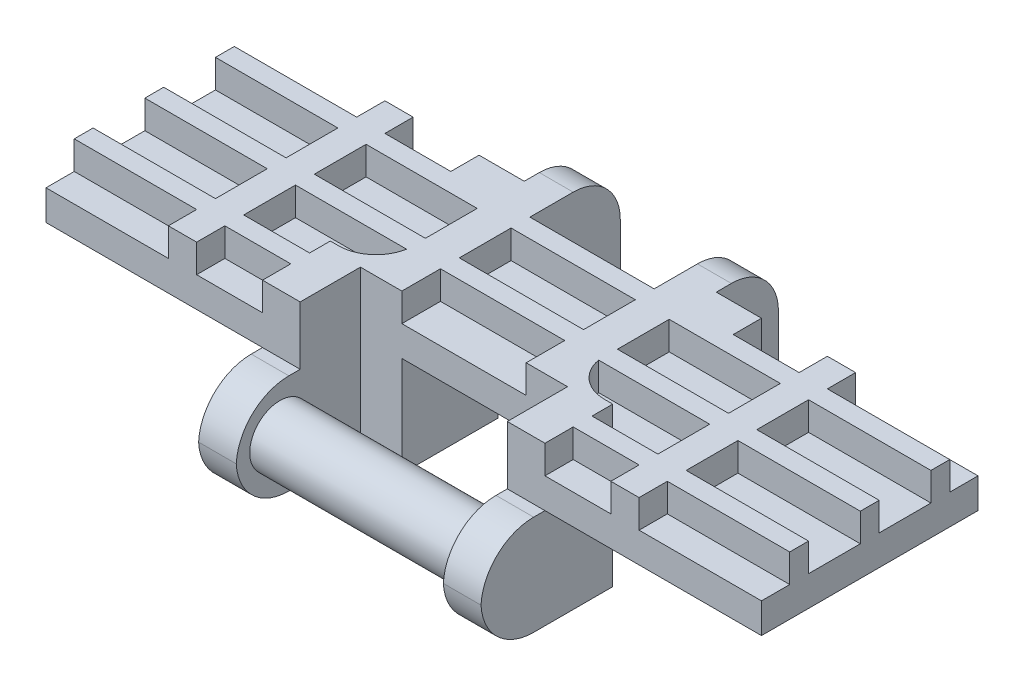
from build123d import *

# Parameters (mm, degrees)
SKETCH_1_W               = 38
SKETCH_1_H               = 11.5
EXTRUDE_1_DEPTH          = 1.6
EXTRUDE_START            = 1.6
SKETCH_1_3_W             = 38
SKETCH_1_3_H             = 1
SKETCH_1_3_W_2           = 1.5
SKETCH_1_3_H_2           = 11.5
EXTRUDE_2_DEPTH          = 1.5
EXTRUDE_START_2          = 3.1
EXTRUDE_3_DEPTH          = 8.4
SKETCH_2_4_W             = 2.4
SKETCH_2_4_H             = 1.5
EXTRUDE_5_DEPTH          = 3.1
CUT_EXTRUDE_1_DEPTH      = 22.744252114
FILLET_1_R               = 3
EXTRUDE_4_REACH          = 28.684
SKETCH_3_R               = 1.6
CUT_EXTRUDE_2_DEPTH      = 27.684499246
CUT_EXTRUDE_2_DEPTH_BACK = 27.684499246
SKETCH_3_3_R             = 1.7
SKETCH_3_3_W             = 6.5
SKETCH_3_3_H             = 1.7
SKETCH_3_3_W_2           = 3.4
SKETCH_3_3_H_2           = 3.1
FILLET_2_R               = 2.8
FILLET_3_R               = 2.5
FILLET_4_R               = 1
FILLET_5_R               = 0.5
FILLET_6_R               = 2


with BuildPart() as part:
    # 草图1 → 凸台-拉伸1 (new body)
    with BuildSketch(Plane(origin=(0, 0, 0), x_dir=(1, 0, 0), z_dir=(0, 1, 0))):
        Rectangle(SKETCH_1_W, SKETCH_1_H)
    extrude(amount=EXTRUDE_1_DEPTH)

    # 草图1<3> → 凸台-拉伸2 (add)
    with BuildSketch(Plane(origin=(0, 0, 0), x_dir=(1, 0, 0), z_dir=(0, 1, 0)).offset(EXTRUDE_START)):
        with Locations((0, 3.75)):
            Rectangle(SKETCH_1_3_W, SKETCH_1_3_H)
        Rectangle(SKETCH_1_3_W, SKETCH_1_3_H)
        with Locations((0, -3.75)):
            Rectangle(SKETCH_1_3_W, SKETCH_1_3_H)
        with Locations((-11.75, 0)):
            Rectangle(SKETCH_1_3_W_2, SKETCH_1_3_H_2)
        with Locations((11.75, 0)):
            Rectangle(SKETCH_1_3_W_2, SKETCH_1_3_H_2)
    extrude(amount=EXTRUDE_2_DEPTH)

    # 草图2 → 凸台-拉伸3 (add)
    with BuildSketch(Plane(origin=(0, 0, 0), x_dir=(1, 0, 0), z_dir=(0, 1, 0)).offset(EXTRUDE_START_2)):
        Polygon((-3.3, 9.05), (-5.1, 9.05), (-5.1, -2.15), (-7.5, -2.15), (-7.5, -9.15), (-5.5, -9.15), (-5.5, -2.55), (-3.3, -2.55), align=None)
        Polygon((5.1, 9.05), (3.3, 9.05), (3.3, -2.55), (5.5, -2.55), (5.5, -9.15), (7.5, -9.15), (7.5, -2.15), (5.1, -2.15), align=None)
    extrude(amount=-EXTRUDE_3_DEPTH)

    # 草图2<4> → 凸台-拉伸5 (add)
    with BuildSketch(Plane(origin=(0, 0, 0), x_dir=(1, 0, 0), z_dir=(0, 1, 0))):
        with Locations((-6.3, 5)):
            Rectangle(SKETCH_2_4_W, SKETCH_2_4_H)
        with Locations((6.3, 5)):
            Rectangle(SKETCH_2_4_W, SKETCH_2_4_H)
    extrude(amount=EXTRUDE_5_DEPTH)

    # 草图2<3> → 切除-拉伸1 (cut, through all)
    with BuildSketch(Plane(origin=(0, 0, 0), x_dir=(1, 0, 0), z_dir=(0, 1, 0))):
        Polygon((0, -9.15), (0, -2.55), (-3.3, -2.55), (-5.1, -2.55), (-5.5, -2.55), (-5.5, -9.15), align=None)
        Polygon((3.3, -2.55), (0, -2.55), (0, -9.15), (5.5, -9.15), (5.5, -2.55), (5.1, -2.55), align=None)
    extrude(amount=CUT_EXTRUDE_1_DEPTH, mode=Mode.SUBTRACT)

    # 圆角1
    # the kernel refuses this fillet: 3 mm, written as the material it adds along each edge
    with BuildSketch(Plane(origin=(5.1, 7.348469228, 2.15), x_dir=(0, 0, -1), z_dir=(0, -1, 0))) as fillet_1_piece_1_section:
        with BuildLine():
            CenterArc((2.939387691, 3), FILLET_1_R, 191.536959033, 78.463040967)
            Line((0, 2.4), (0, 0))
            Line((0, 0), (2.939387691, 0))
        make_face()
    fillet_1_piece_1 = extrude(amount=12.648469228, mode=Mode.PRIVATE)
    fillet_1_piece_1 = split(fillet_1_piece_1, bisect_by=Plane(origin=(5.102900281, 1.6, -0.644495887), z_dir=(0, -1, 0)), keep=Keep.TOP, mode=Mode.PRIVATE)
    add(fillet_1_piece_1)
    with BuildSketch(Plane(origin=(-5.1, 0, 2.15), x_dir=(0, 0, -1), z_dir=(0, -1, 0))) as fillet_1_piece_2:
        with BuildLine():
            CenterArc((2.939387691, -3), FILLET_1_R, 90, 78.463040967)
            Line((0, -2.4), (0, 0))
            Line((0, 0), (2.939387691, 0))
        make_face()
    extrude(amount=5.3)

    # 草图3 → 凸台-拉伸4 (add, up to next)
    with BuildSketch(Plane(origin=(-5.5, 0, 0), x_dir=(0, 0, -1), z_dir=(1, 0, 0)), mode=Mode.PRIVATE) as extrude_4_sk1:
        with Locations((-6.83, -2.5)):
            Circle(SKETCH_3_R)
    extrude_4_tool1 = extrude(extrude_4_sk1.sketch, amount=EXTRUDE_4_REACH, mode=Mode.PRIVATE) - part.part
    add(extrude_4_tool1.solids().sort_by_distance((-5.5, -2.5, 6.83))[0])

    # 草图3<3> → 切除-拉伸2 (cut, two sides: drawn at the far end of the back side and taken through both)
    with BuildSketch(Plane(origin=(-5.5, 0, 0), x_dir=(0, 0, -1), z_dir=(1, 0, 0)).offset(-CUT_EXTRUDE_2_DEPTH_BACK)):
        with Locations((5.75, -2.5)):
            Circle(SKETCH_3_3_R)
        with Locations((5.8, -4.45)):
            Rectangle(SKETCH_3_3_W, SKETCH_3_3_H)
        with Locations((-7.45, 1.55)):
            Rectangle(SKETCH_3_3_W_2, SKETCH_3_3_H_2)
    extrude(amount=CUT_EXTRUDE_2_DEPTH + CUT_EXTRUDE_2_DEPTH_BACK, mode=Mode.SUBTRACT)

    # 圆角2
    # the kernel refuses this fillet: 2.8 mm, written as the material it takes off along each edge
    with BuildSketch(Plane(origin=(-1.5, 0, 9.15), x_dir=(0, 0, -1), z_dir=(1, 0, 0)), Plane(origin=(-14.5, 0, 9.15), x_dir=(0, 0, -1), z_dir=(1, 0, 0))) as fillet_2_piece_1:
        with BuildLine():
            CenterArc((FILLET_2_R, -FILLET_2_R), FILLET_2_R, 90, 90)
            Line((0, -FILLET_2_R), (0, 0))
            Line((0, 0), (FILLET_2_R, 0))
        make_face()
    extrude(amount=16, mode=Mode.SUBTRACT)
    with BuildSketch(Plane(origin=(-1.5, -5.3, 9.15), x_dir=(0, 0, -1), z_dir=(1, 0, 0)), Plane(origin=(-14.5, -5.3, 9.15), x_dir=(0, 0, -1), z_dir=(1, 0, 0))) as fillet_2_piece_2:
        with BuildLine():
            CenterArc((FILLET_2_R, FILLET_2_R), FILLET_2_R, 180, 90)
            Line((0, FILLET_2_R), (0, 0))
            Line((0, 0), (FILLET_2_R, 0))
        make_face()
    extrude(amount=16, mode=Mode.SUBTRACT)

    # 圆角3
    fillet_3_edges = [part.edges().sort_by_distance(p)[0] for p in [
        (-4.2, 3.1, -9.05),
        (4.2, 3.1, -9.05),
    ]]
    fillet(fillet_3_edges, radius=FILLET_3_R)

    # 圆角4
    fillet_4_edges = [part.edges().sort_by_distance(p)[0] for p in [
        (-4.2, -3.6, -9.05),
        (4.2, -3.6, -9.05),
    ]]
    fillet(fillet_4_edges, radius=FILLET_4_R)

    # 圆角5
    fillet_5_edges = [part.edges().sort_by_distance(p)[0] for p in [
        (-4.2, -3.6, -4.45385186),
        (4.2, -3.6, -4.45385186),
        (-4.2, -3.6, -7.04614814),
        (4.2, -3.6, -7.04614814),
    ]]
    fillet(fillet_5_edges, radius=FILLET_5_R)

    # 圆角6
    # the kernel refuses this fillet: 2 mm, written as the material it adds along each edge
    with BuildSketch(Plane(origin=(5.1, 3.1, 2.15), x_dir=(0, 0, -1), z_dir=(0, -1, 0))) as fillet_6_piece_1:
        with BuildLine():
            CenterArc((2, 1.969136867), FILLET_6_R, 180, 79.921341892)
            Line((0, 1.969136867), (-0.04, 1.969136867))
            Line((-0.04, 1.969136867), (-0.04, 0))
            Line((-0.04, 0), (0, -0.04))
            ThreePointArc((0, -0.04), (0.825, -0.04), (1.643, -0.039382737))
            Line((1.643, -0.039382737), (1.65, 0))
        make_face()
    extrude(amount=6.422842167)
    with BuildSketch(Plane(origin=(-5.1, 3.1, 2.15), x_dir=(-1, 0, 0), z_dir=(0, -1, 0))) as fillet_6_piece_2:
        with BuildLine():
            CenterArc((1.969136867, 2), FILLET_6_R, 190.078658108, 79.921341892)
            Line((0, 1.65), (-0.039382737, 1.643))
            ThreePointArc((-0.039382737, 1.643), (-0.04, 0.825), (-0.04, 0))
            Line((-0.04, 0), (0, -0.04))
            Line((0, -0.04), (1.969136867, -0.04))
            Line((1.969136867, -0.04), (1.969136867, 0))
        make_face()
    extrude(amount=6.422842167)


solid = part.part
